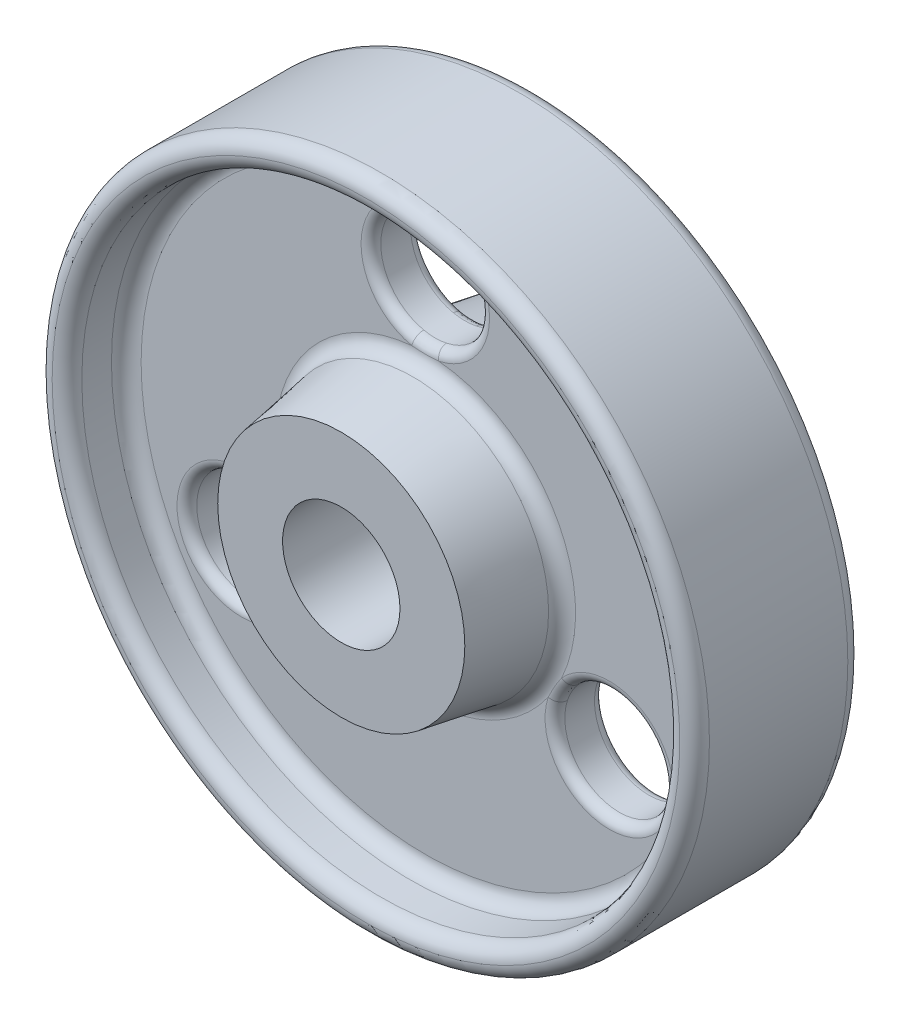
from build123d import *

# Parameters (mm, degrees)
CUT_EXTRUDE1_START     = -5
CUT_EXTRUDE1_OUTLINE_R = 11
CUT_EXTRUDE1_DEPTH     = 10
CIRPATTERN1_COUNT      = 3
FILLET1_R              = 3
FILLET2_R              = 3
FILLET3_R              = 2


# Read off the part's stored shape, not the designer's step: Revolve1, Cut-Extrude1
with BuildPart() as part:
    # Revolve1 outline → Revolve1 (revolve)
    with BuildSketch(Plane.XZ):
        Polygon((11.875, -22), (25, -22), (27.875, -5), (60.5, -5), (60.5, -17), (66.5, -17), (66.5, 17), (60.5, 17), (60.5, 5), (27.875, 5), (25, 22), (11.875, 22), align=None)
    revolve(axis=Axis((0, 0, 0), (0, 0, 1)))

    # Cut-Extrude1 outline → Cut-Extrude1 (cut)
    with BuildSketch(Plane.XY.offset(CUT_EXTRUDE1_START)):
        with Locations((0, 43)):
            Circle(CUT_EXTRUDE1_OUTLINE_R)
    cut_extrude1 = extrude(amount=CUT_EXTRUDE1_DEPTH, mode=Mode.SUBTRACT)

    # CirPattern1: Cut-Extrude1 ×3 about axis
    cirpattern1_axis = Axis((0, 0, 0), (0, 0, 1))
    for i in range(1, CIRPATTERN1_COUNT):
        add(cut_extrude1.rotate(cirpattern1_axis, i * 360 / CIRPATTERN1_COUNT), mode=Mode.SUBTRACT)

    # Fillet1
    fillet1_edges = [part.edges().sort_by_distance(p)[0] for p in [
        (-66.5, 0, 17),
        (-60.5, 0, 17),
        (-60.5, 0, -17),
        (-66.5, 0, -17),
    ]]
    fillet(fillet1_edges, radius=FILLET1_R - 0.0001)  # a hair under: the kernel refuses the full size

    # Fillet2
    fillet2_edges = [part.edges().sort_by_distance(p)[0] for p in [
        (-60.5, 0, 5),
        (-27.875, 0, 5),
        (-27.875, 0, -5),
        (-60.5, 0, -5),
    ]]
    fillet(fillet2_edges, radius=FILLET2_R)

    # Fillet3
    fillet3_edges = [part.edges().sort_by_distance(p)[0] for p in [
        (-11, 43, -5),
        (-11, 43, 5),
        (-31.739092363, -31.026279442, -5),
        (-31.739092363, -31.026279442, 5),
        (42.739092363, -11.973720558, -5),
        (42.739092363, -11.973720558, 5),
    ]]
    fillet(fillet3_edges, radius=FILLET3_R)


solid = part.part
